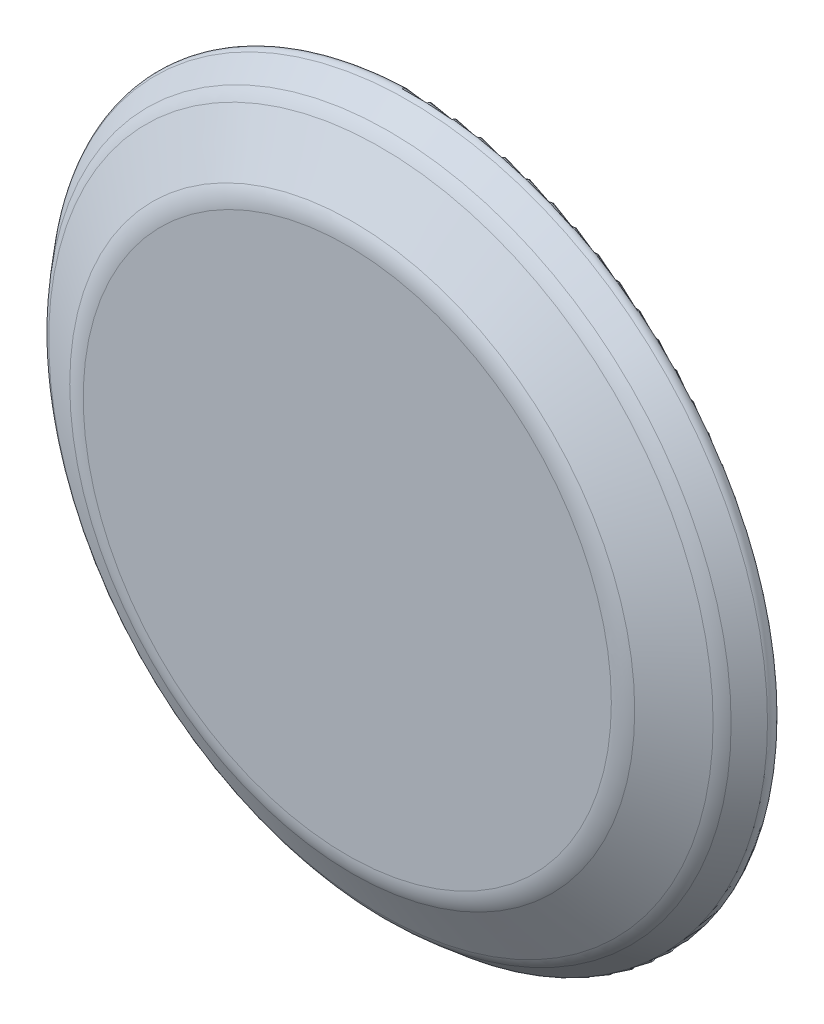
from build123d import *

# Parameters (mm, degrees)
SKETCH1_R           = 100
BOSS_EXTRUDE1_DEPTH = 10
BOSS_EXTRUDE1_TAPER = 40
SKETCH2_R           = 91.609003688
BOSS_EXTRUDE2_DEPTH = 10
BOSS_EXTRUDE2_TAPER = 60
FILLET1_R           = 10
FILLET2_R           = 2


# Read off the part's stored shape, not the designer's step: Shell1
with BuildPart() as part:
    # Sketch1 → Boss-Extrude1 (new body)
    with BuildSketch(Plane.XY):
        Circle(SKETCH1_R)
    extrude(amount=BOSS_EXTRUDE1_DEPTH, taper=BOSS_EXTRUDE1_TAPER)

    # Sketch2 → Boss-Extrude2 (add)
    with BuildSketch(Plane.XY.offset(10)):
        Circle(SKETCH2_R)
    extrude(amount=BOSS_EXTRUDE2_DEPTH, taper=BOSS_EXTRUDE2_TAPER)

    # Fillet1
    fillet1_edges = [part.edges().sort_by_distance(p)[0] for p in [
        (-91.609003688, 0, 10),
        (-74.288495613, 0, 20),
    ]]
    fillet(fillet1_edges, radius=FILLET1_R)

    # Fillet2
    fillet2_edges = [part.edges().sort_by_distance(p)[0] for p in [
        (-100, 0, 0),
    ]]
    fillet(fillet2_edges, radius=FILLET2_R)

    # Shell1 outline → Shell1 (revolve, cut)
    with BuildSketch(Plane.XZ):
        with BuildLine():
            Line((93.472963553, 0), (88.912189457, 5.435318914))
            ThreePointArc((88.912189457, 5.435318914), (88.29590529, 6.051603081), (87.581967242, 6.551507885))
            Line((87.581967242, 6.551507885), (74.109003688, 14.330127019))
            ThreePointArc((74.109003688, 14.330127019), (72.903098913, 14.829629131), (71.609003688, 15))
            Line((71.609003688, 15), (0, 15))
            Line((0, 15), (0, 0))
            Line((0, 0), (93.472963553, 0))
        make_face()
    revolve(axis=Axis((0, 0, 0), (0, 0, 1)), mode=Mode.SUBTRACT)


solid = part.part
